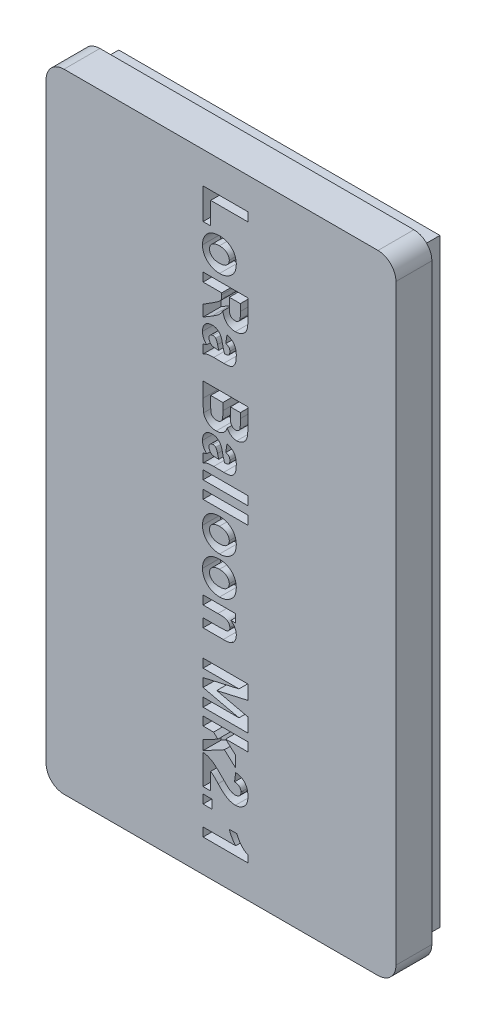
from build123d import *

# Parameters (mm, degrees)
SKETCH1_W           = 39
SKETCH1_H           = 70
BOSS_EXTRUDE1_DEPTH = 4
SKETCH2_W           = 35.8
SKETCH2_H           = 66.8
SKETCH2_W_2         = 32.2
SKETCH2_H_2         = 63.2
BOSS_EXTRUDE2_DEPTH = 2.5
SKETCH3_W           = 5
SKETCH3_H           = 0.974025974
SKETCH3_W_2         = 0.974025974
CUT_EXTRUDE1_DEPTH  = 2
FILLET1_R           = 2


with BuildPart() as part:
    # Sketch1 → Boss-Extrude1 (new body)
    with BuildSketch(Plane.XY):
        with Locations((19.5, 35)):
            Rectangle(SKETCH1_W, SKETCH1_H)
    extrude(amount=BOSS_EXTRUDE1_DEPTH)

    # Sketch2 → Boss-Extrude2 (add)
    with BuildSketch(Plane(origin=(0, 0, 0), x_dir=(-1, 0, 0), z_dir=(0, 0, -1))):
        with Locations((-19.5, 35)):
            Rectangle(SKETCH2_W, SKETCH2_H)
        with Locations((-19.5, 35)):
            Rectangle(SKETCH2_W_2, SKETCH2_H_2, mode=Mode.SUBTRACT)
    extrude(amount=BOSS_EXTRUDE2_DEPTH)

    # Sketch3 → Cut-Extrude1 (cut)
    # profile 1 of 16: a face of its own
    with BuildSketch(Plane.XY.offset(4)):
        Polygon((17.5, 66.480519481), (22.5, 66.480519481), (22.5, 65.506493506), (18.344155844, 65.506493506), (18.344155844, 63.038961039), (17.5, 63.038961039), align=None)
    # profile 2 of 16: a face of its own
    with BuildSketch(Plane.XY.offset(4)):
        with BuildLine():
            add(Edge.make_bspline(
                [(19.368912338, 62.584415584), (19.412557514, 62.583528419), (19.49897445, 62.581771843), (19.627236649, 62.5710115), (19.752443405, 62.550019945), (19.874785917, 62.522884131), (19.994516204, 62.488790148), (20.110184764, 62.444132033), (20.223974613, 62.394264811), (20.333175225, 62.334768256), (20.438197721, 62.270617637), (20.536987544, 62.200578377), (20.628149795, 62.124897448), (20.714126756, 62.046482053), (20.791131896, 61.96084051), (20.863823807, 61.87250186), (20.92718966, 61.777238739), (20.985571825, 61.679054138), (21.035971814, 61.57595743), (21.08098851, 61.470239525), (21.116953951, 61.36023349), (21.149170134, 61.248554471), (21.171961312, 61.132698684), (21.189429104, 61.014236637), (21.199791408, 60.892231578), (21.200792678, 60.809881336), (21.201298701, 60.768262987)],
                knots=[0, 0, 0, 0, 1.087797627, 2.153826546, 3.204146119, 4.249074796, 5.276002369, 6.302929943, 7.33671768, 8.369955531, 9.399197913, 10.402506754, 11.384561342, 12.350717656, 13.299250364, 14.252266119, 15.199037181, 16.147307724, 17.097187567, 18.056740571, 19.008264324, 19.97962709, 20.951574749, 21.948063114, 22.962987564, 24, 24, 24, 24], degree=3))
            add(Edge.make_bspline(
                [(21.201298701, 60.768262987), (21.199450512, 60.699196986), (21.195849872, 60.564642667), (21.170584758, 60.368376346), (21.126764803, 60.183837211), (21.066175813, 60.009883847), (20.986134267, 59.848038854), (20.89046985, 59.696280054), (20.776185609, 59.556703738), (20.645110832, 59.431081694), (20.503737769, 59.317759151), (20.354365117, 59.219397997), (20.199648716, 59.135604234), (20.038921137, 59.06728619), (19.872434276, 59.012800493), (19.69920372, 58.976348227), (19.520815843, 58.951385416), (19.399776993, 58.949172654), (19.338474026, 58.948051948)],
                knots=[0, 0, 0, 0, 1.136040707, 2.213233445, 3.248238065, 4.25119704, 5.236487175, 6.211911138, 7.196384178, 8.195725979, 9.1931767, 10.173001403, 11.133846892, 12.083513917, 13.042376269, 14.010298635, 14.992269034, 16, 16, 16, 16], degree=3))
            add(Edge.make_bspline(
                [(19.338474026, 58.948051948), (19.292785106, 58.948788827), (19.202258032, 58.950248863), (19.068171932, 58.963209219), (18.937242639, 58.981822592), (18.809553931, 59.009724143), (18.685290231, 59.044636463), (18.564480208, 59.089004836), (18.44727316, 59.140577304), (18.333494925, 59.199149596), (18.225970918, 59.265135773), (18.123494513, 59.334835969), (18.029544059, 59.411267865), (17.941646307, 59.491770536), (17.860288246, 59.576913906), (17.78604347, 59.667487133), (17.718822759, 59.763088903), (17.659365223, 59.863436801), (17.60640402, 59.967101274), (17.560648674, 60.073877485), (17.522295574, 60.183113435), (17.490858341, 60.294665106), (17.464721949, 60.408267799), (17.448553753, 60.525095631), (17.436196394, 60.643879325), (17.435443702, 60.723924483), (17.435064935, 60.764204545)],
                knots=[0, 0, 0, 0, 1.117558833, 2.214307803, 3.293244786, 4.351421184, 5.409597582, 6.448807362, 7.497331125, 8.540978692, 9.576922014, 10.582241184, 11.570837346, 12.537122916, 13.496974449, 14.449450387, 15.399839374, 16.353464778, 17.300823134, 18.246083241, 19.193441597, 20.131138339, 21.080698472, 22.042616426, 23.015011865, 24, 24, 24, 24], degree=3))
            add(Edge.make_bspline(
                [(17.435064935, 60.764204545), (17.436658538, 60.82819482), (17.439789185, 60.953904305), (17.463432675, 61.138408962), (17.502852243, 61.314388167), (17.558226745, 61.482119319), (17.627904833, 61.641994397), (17.714623801, 61.793107632), (17.81848662, 61.934619784), (17.935324792, 62.068380592), (18.067007303, 62.190741631), (18.213695075, 62.296408751), (18.373969277, 62.385342747), (18.547080851, 62.458460327), (18.733816486, 62.515186359), (18.933919374, 62.555416358), (19.147111308, 62.580032759), (19.2937634, 62.582930629), (19.368912338, 62.584415584)],
                knots=[0, 0, 0, 0, 1.024594995, 2.012826322, 2.973358778, 3.908543225, 4.837401023, 5.761810751, 6.69243552, 7.644223827, 8.602462928, 9.564551743, 10.532007457, 11.531954493, 12.568505162, 13.651979317, 14.796803673, 16, 16, 16, 16], degree=3))
        make_face()
        with BuildLine():
            add(Edge.make_bspline(
                [(19.318181818, 61.61038961), (19.274202345, 61.609514753), (19.188802006, 61.607815935), (19.06447938, 61.597454177), (18.948875339, 61.576133409), (18.840572969, 61.551320566), (18.74158396, 61.514609688), (18.649820783, 61.472887948), (18.56681123, 61.421567934), (18.493039432, 61.362821614), (18.42822013, 61.298508427), (18.370720871, 61.231285957), (18.322007126, 61.160767582), (18.282867351, 61.08637229), (18.252505923, 61.009070471), (18.22979593, 60.928280791), (18.216410588, 60.84413299), (18.214997021, 60.786910979), (18.214285714, 60.758116883)],
                knots=[0, 0, 0, 0, 1.347985487, 2.617548842, 3.817114289, 4.948286482, 6.017057593, 7.046407217, 8.032969353, 8.999289909, 9.930051738, 10.827140183, 11.706817169, 12.550594062, 13.397420762, 14.247349517, 15.118066881, 16, 16, 16, 16], degree=3))
            add(Edge.make_bspline(
                [(18.214285714, 60.758116883), (18.214996693, 60.729997883), (18.216409584, 60.674118493), (18.22979937, 60.591986829), (18.252500735, 60.513209195), (18.283226956, 60.437266744), (18.322589441, 60.364118347), (18.372121703, 60.295009085), (18.429215162, 60.228477216), (18.495143433, 60.165972865), (18.568962581, 60.10742814), (18.652801437, 60.057929707), (18.744850541, 60.016383128), (18.844755807, 59.9820163), (18.95291975, 59.954389132), (19.06972451, 59.935560347), (19.194861198, 59.924502338), (19.280956327, 59.922901926), (19.325284091, 59.922077922)],
                knots=[0, 0, 0, 0, 0.86498205, 1.718932724, 2.552529207, 3.383717481, 4.236080589, 5.102502034, 5.995588818, 6.930639414, 7.894730959, 8.889086482, 9.918564038, 10.998334367, 12.1369617, 13.350269694, 14.635734454, 16, 16, 16, 16], degree=3))
            add(Edge.make_bspline(
                [(19.325284091, 59.922077922), (19.368590511, 59.92294123), (19.452647024, 59.924616887), (19.574907493, 59.935124228), (19.689038528, 59.955995868), (19.795406311, 59.98277939), (19.894048552, 60.017465181), (19.984674312, 60.059961661), (20.067601966, 60.110789288), (20.141273702, 60.170017786), (20.207179656, 60.233571266), (20.264268467, 60.301112354), (20.313794055, 60.371246694), (20.353151989, 60.445402526), (20.383867427, 60.522357638), (20.406564098, 60.602146516), (20.419954045, 60.685284735), (20.421366945, 60.74183557), (20.422077922, 60.770292208)],
                knots=[0, 0, 0, 0, 1.337232047, 2.595528913, 3.783536199, 4.915617704, 5.97906533, 7.006690339, 8.000659516, 8.974235141, 9.919454987, 10.823278711, 11.700968276, 12.565199868, 13.408680491, 14.254935835, 15.121875735, 16, 16, 16, 16], degree=3))
            add(Edge.make_bspline(
                [(20.422077922, 60.770292208), (20.421415795, 60.798756777), (20.420115523, 60.854654965), (20.40626498, 60.937027866), (20.384085777, 61.015940839), (20.353098004, 61.092139731), (20.313828021, 61.165346709), (20.263910312, 61.234471195), (20.207514915, 61.301932386), (20.141196663, 61.364462993), (20.067164898, 61.422965991), (19.98383727, 61.473238788), (19.892800776, 61.516296387), (19.793326134, 61.550568631), (19.686106775, 61.57781848), (19.57038669, 61.59703671), (19.446909753, 61.607908449), (19.361831476, 61.609548287), (19.318181818, 61.61038961)],
                knots=[0, 0, 0, 0, 0.8777483, 1.723705717, 2.56959874, 3.403036217, 4.257705828, 5.126471818, 6.029908573, 6.967489424, 7.934189811, 8.936630112, 9.963815147, 11.036651848, 12.178360317, 13.374360467, 14.652907978, 16, 16, 16, 16], degree=3))
        make_face(mode=Mode.SUBTRACT)
    # profile 3 of 16: a face of its own
    with BuildSketch(Plane.XY.offset(4)):
        with BuildLine():
            Line((17.5, 58.168831169), (22.5, 58.168831169))
            Line((22.5, 58.168831169), (22.5, 56.110186688))
            add(Edge.make_bspline(
                [(22.5, 56.110186688), (22.49959964, 56.046602106), (22.498828535, 55.924136317), (22.493283254, 55.747468762), (22.481516393, 55.585151171), (22.468334076, 55.43675353), (22.44896646, 55.30271048), (22.42582199, 55.182450855), (22.399160183, 55.076128095), (22.35746947, 54.953987396), (22.289037207, 54.817258993), (22.182950283, 54.66927317), (22.052390783, 54.53611038), (21.925015541, 54.43986879), (21.812438114, 54.37314975), (21.723389173, 54.327896019), (21.629222447, 54.291835754), (21.531340355, 54.261110267), (21.429311402, 54.236872009), (21.322862278, 54.219582969), (21.212666288, 54.209296583), (21.137738396, 54.208297549), (21.099837662, 54.207792208)],
                knots=[0, 0, 0, 0, 1.403336213, 2.702867097, 3.89994726, 4.994709233, 5.990128961, 6.887471613, 7.696701944, 8.407207329, 9.732421867, 11.053910544, 12.410433107, 13.833109191, 14.562763883, 15.297137368, 16.03453921, 16.78526912, 17.560138056, 18.346710252, 19.163717375, 20, 20, 20, 20], degree=3))
            add(Edge.make_bspline(
                [(21.099837662, 54.207792208), (21.05209605, 54.208614176), (20.95868939, 54.21022236), (20.822344048, 54.22725247), (20.692703782, 54.252832759), (20.570856368, 54.291197991), (20.454791296, 54.337103071), (20.347190843, 54.396787046), (20.24618256, 54.465982623), (20.152440065, 54.5452996), (20.067090469, 54.635039834), (19.990096905, 54.733862805), (19.920315295, 54.840706945), (19.860965804, 54.957551266), (19.807585822, 55.082277929), (19.764568325, 55.216986165), (19.728740241, 55.360000336), (19.712183605, 55.459007884), (19.703733766, 55.509537338)],
                knots=[0, 0, 0, 0, 1.084141299, 2.12112686, 3.117250271, 4.082180618, 5.019674211, 5.948149429, 6.871043381, 7.797863675, 8.732676681, 9.679570512, 10.640822351, 11.627176691, 12.653315453, 13.72007994, 14.836420889, 16, 16, 16, 16], degree=3))
            add(Edge.make_bspline(
                [(19.703733766, 55.509537338), (19.672285899, 55.457018332), (19.611037345, 55.354731166), (19.509893003, 55.212066964), (19.404961729, 55.083111517), (19.310752977, 54.984867186), (19.227578847, 54.909973227), (19.154264031, 54.850296479), (19.069920557, 54.786454973), (18.973984887, 54.718383278), (18.866785434, 54.645602751), (18.747978614, 54.56859415), (18.617651859, 54.487241259), (18.526522549, 54.432236426), (18.479099026, 54.403612013)],
                knots=[0, 0, 0, 0, 1.316447784, 2.563942512, 3.758196669, 4.89017242, 5.487731481, 6.164970468, 6.923081098, 7.76291089, 8.695186333, 9.710230341, 10.808408125, 12, 12, 12, 12], degree=3))
            Line((18.479099026, 54.403612013), (17.5, 53.818181818))
            Line((17.5, 53.818181818), (17.5, 55.052962662))
            Line((17.5, 55.052962662), (18.576501623, 55.745941558))
            add(Edge.make_bspline(
                [(18.576501623, 55.745941558), (18.622838875, 55.776035915), (18.711185346, 55.833413728), (18.836924232, 55.915199926), (18.948969559, 55.989958436), (19.048256469, 56.055680165), (19.132514105, 56.116606493), (19.204439987, 56.16757582), (19.262804516, 56.211341042), (19.321633384, 56.258982938), (19.380679389, 56.315703915), (19.440089246, 56.3840759), (19.486730917, 56.455464852), (19.523082043, 56.531650484), (19.549023303, 56.620907303), (19.56623292, 56.72849369), (19.575452702, 56.858133753), (19.577057051, 56.951622344), (19.577922078, 57.002029221)],
                knots=[0, 0, 0, 0, 1.540630534, 2.937361724, 4.182336204, 5.296545873, 6.256860607, 7.081241145, 7.754565199, 8.290682583, 9.191113071, 10.033949391, 10.810788607, 11.561665679, 12.379113064, 13.39303176, 14.594383257, 16, 16, 16, 16], degree=3))
            Line((19.577922078, 57.002029221), (19.577922078, 57.194805195))
            Line((19.577922078, 57.194805195), (17.5, 57.194805195))
            Line((17.5, 57.194805195), (17.5, 58.168831169))
        make_face()
        with BuildLine():
            Line((20.422077922, 57.194805195), (20.422077922, 56.480519481))
            add(Edge.make_bspline(
                [(20.422077922, 56.480519481), (20.422360992, 56.428436187), (20.422899583, 56.329338772), (20.424522386, 56.187944599), (20.428762736, 56.061455316), (20.433738572, 55.949833792), (20.439463925, 55.853034526), (20.447175783, 55.771067013), (20.45718866, 55.704030712), (20.471404412, 55.635039214), (20.497429019, 55.56218402), (20.541179974, 55.485039129), (20.595020472, 55.414693496), (20.662845147, 55.354665816), (20.74267145, 55.305026133), (20.835511744, 55.270942117), (20.939989681, 55.25048374), (21.013494264, 55.248038972), (21.052150974, 55.246753247)],
                knots=[0, 0, 0, 0, 1.560937284, 2.96995135, 4.237567709, 5.353650601, 6.318464703, 7.143454388, 7.820048429, 8.348858403, 9.25293029, 10.124191563, 10.998043079, 11.895328271, 12.823620657, 13.798761283, 14.842349086, 16, 16, 16, 16], degree=3))
            add(Edge.make_bspline(
                [(21.052150974, 55.246753247), (21.089110033, 55.248089887), (21.159913547, 55.250650527), (21.260502807, 55.270707591), (21.349801982, 55.30534349), (21.426865286, 55.354919176), (21.492474654, 55.4165156), (21.546236077, 55.488760187), (21.591503058, 55.569477796), (21.609903288, 55.629161273), (21.619318182, 55.659699675)],
                knots=[0, 0, 0, 0, 1.164311867, 2.230505154, 3.21629184, 4.165493112, 5.100643873, 6.036584124, 6.995373831, 8, 8, 8, 8], degree=3))
            add(Edge.make_bspline(
                [(21.619318182, 55.659699675), (21.622152214, 55.673542437), (21.628891215, 55.706458933), (21.636815241, 55.764342618), (21.642174412, 55.838215662), (21.647313084, 55.927849931), (21.651101857, 56.033393596), (21.654449891, 56.155147368), (21.654715225, 56.292818734), (21.655454959, 56.389881783), (21.655844156, 56.440949675)],
                knots=[0, 0, 0, 0, 0.432971861, 1.029557334, 1.788740938, 2.702316591, 3.781055348, 5.025222918, 6.434877167, 8, 8, 8, 8], degree=3))
            Line((21.655844156, 56.440949675), (21.655844156, 57.194805195))
            Line((21.655844156, 57.194805195), (20.422077922, 57.194805195))
        make_face(mode=Mode.SUBTRACT)
    # profile 4 of 16: a face of its own
    with BuildSketch(Plane.XY.offset(4)):
        with BuildLine():
            Line((20.032467532, 52.519480519), (20.162337662, 53.428571429))
            add(Edge.make_bspline(
                [(20.162337662, 53.428571429), (20.20719306, 53.415691623), (20.294450645, 53.390636429), (20.418210578, 53.34335307), (20.533095669, 53.292058446), (20.637670757, 53.2327813), (20.733439233, 53.168522975), (20.818332941, 53.09658976), (20.893880795, 53.019221267), (20.960550687, 52.935474488), (21.018112561, 52.843478314), (21.067731107, 52.742880485), (21.109302392, 52.632741745), (21.142396799, 52.513422221), (21.168715692, 52.384935912), (21.187893956, 52.247034659), (21.198845125, 52.099609618), (21.20046527, 51.998327146), (21.201298701, 51.946225649)],
                knots=[0, 0, 0, 0, 1.125515524, 2.189474865, 3.193709533, 4.158305409, 5.086274303, 5.972285183, 6.837881566, 7.691743787, 8.549806887, 9.451203831, 10.393874208, 11.385866739, 12.435713252, 13.556277782, 14.742906037, 16, 16, 16, 16], degree=3))
            add(Edge.make_bspline(
                [(21.201298701, 51.946225649), (21.201065942, 51.899877691), (21.200613715, 51.809828678), (21.192639745, 51.678941652), (21.183453447, 51.556293549), (21.168254125, 51.442124789), (21.147871153, 51.336527011), (21.123918854, 51.239177262), (21.095484812, 51.150333568), (21.053298642, 51.045537469), (20.990036334, 50.930029242), (20.901736264, 50.808898551), (20.798905797, 50.710331005), (20.701948242, 50.644080397), (20.613079567, 50.60315076), (20.533918189, 50.577669987), (20.442731226, 50.555247458), (20.339287857, 50.537500848), (20.223475224, 50.523487201), (20.095514823, 50.513621989), (19.955416661, 50.507532466), (19.857961248, 50.506849219), (19.807224026, 50.506493506)],
                knots=[0, 0, 0, 0, 1.172645795, 2.278322549, 3.317437237, 4.284552983, 5.190951134, 6.037858116, 6.820064311, 7.549551753, 8.893788561, 10.141635195, 11.328036199, 12.481663495, 13.094362176, 13.79803918, 14.582676335, 15.469136844, 16.45214095, 17.533908717, 18.716103928, 20, 20, 20, 20], degree=3))
            Line((19.807224026, 50.506493506), (18.689123377, 50.51461039))
            add(Edge.make_bspline(
                [(18.689123377, 50.51461039), (18.651245726, 50.514294596), (18.577852753, 50.513682703), (18.471594239, 50.512431592), (18.372858153, 50.506800527), (18.281554432, 50.500655264), (18.197471505, 50.494505328), (18.121165633, 50.483591402), (18.052284959, 50.473158955), (17.969560894, 50.455108068), (17.869356028, 50.42503735), (17.74867523, 50.378093511), (17.624021205, 50.319072636), (17.542270007, 50.271401782), (17.5, 50.246753247)],
                knots=[0, 0, 0, 0, 1.100960395, 2.13325684, 3.08799504, 3.974623839, 4.793377983, 5.537123068, 6.214225653, 6.817686965, 7.996461938, 9.250537039, 10.578371695, 12, 12, 12, 12], degree=3))
            Line((17.5, 50.246753247), (17.5, 51.220779221))
            Line((17.5, 51.220779221), (17.897727273, 51.339488636))
            add(Edge.make_bspline(
                [(17.897727273, 51.339488636), (17.859360735, 51.378659846), (17.784707234, 51.454879074), (17.688641004, 51.579374361), (17.607826166, 51.707185677), (17.543543882, 51.840060964), (17.494429822, 51.977200236), (17.460175543, 52.118356728), (17.439245859, 52.263849149), (17.436470563, 52.362146366), (17.435064935, 52.411931818)],
                knots=[0, 0, 0, 0, 1.094238684, 2.129166538, 3.133671034, 4.10942336, 5.070833053, 6.037377746, 7.005973528, 8, 8, 8, 8], degree=3))
            add(Edge.make_bspline(
                [(17.435064935, 52.411931818), (17.436196198, 52.452883747), (17.438417837, 52.533307461), (17.451225957, 52.651233519), (17.474624664, 52.763299387), (17.5076296, 52.869303813), (17.547536028, 52.970535302), (17.599137275, 53.065280202), (17.658950235, 53.154839855), (17.72770078, 53.238115806), (17.804914915, 53.312403446), (17.886913645, 53.37988358), (17.977266308, 53.433812533), (18.071973861, 53.480965293), (18.174096818, 53.514377114), (18.281528935, 53.540376537), (18.395128698, 53.555597497), (18.472967275, 53.557482325), (18.512581169, 53.558441558)],
                knots=[0, 0, 0, 0, 1.111028414, 2.181900458, 3.212888925, 4.21115239, 5.190734394, 6.159429897, 7.131421471, 8.108723925, 9.081883785, 10.034678926, 10.981892532, 11.929727932, 12.898727489, 13.888948844, 14.925636122, 16, 16, 16, 16], degree=3))
            add(Edge.make_bspline(
                [(18.512581169, 53.558441558), (18.562728581, 53.556889309), (18.660210948, 53.553871867), (18.801417536, 53.530305427), (18.932652513, 53.49093437), (19.053137607, 53.434421777), (19.162868726, 53.36437675), (19.262007438, 53.281256988), (19.348206816, 53.183941956), (19.411268145, 53.092633998), (19.457348311, 53.010976391), (19.488801873, 52.939353837), (19.521903707, 52.860662202), (19.551693844, 52.772493261), (19.582392237, 52.676262773), (19.611730086, 52.571066917), (19.638745813, 52.456793731), (19.656154942, 52.377796886), (19.665178571, 52.336850649)],
                knots=[0, 0, 0, 0, 1.294162278, 2.515743014, 3.684113667, 4.820865117, 5.939906549, 7.036651616, 8.149715676, 9.285662014, 9.895437351, 10.567486448, 11.303637924, 12.098932185, 12.968810962, 13.91153998, 14.917493754, 16, 16, 16, 16], degree=3))
            add(Edge.make_bspline(
                [(19.665178571, 52.336850649), (19.675447193, 52.287425487), (19.695178402, 52.192454782), (19.727063699, 52.056316793), (19.757224442, 51.931779605), (19.786558499, 51.818685487), (19.815533819, 51.717366448), (19.845353454, 51.627940328), (19.873024169, 51.549807839), (19.893250832, 51.502417949), (19.902597403, 51.480519481)],
                knots=[0, 0, 0, 0, 1.361164628, 2.615484881, 3.770095419, 4.816364149, 5.765912261, 6.610903979, 7.358110453, 8, 8, 8, 8], degree=3))
            add(Edge.make_bspline(
                [(19.902597403, 51.480519481), (19.946562127, 51.481232522), (20.026443529, 51.482528078), (20.134084546, 51.488297217), (20.217051281, 51.500778797), (20.279754281, 51.51823568), (20.326272153, 51.546991338), (20.366333468, 51.581441425), (20.40050469, 51.626229317), (20.431853941, 51.678910853), (20.457013728, 51.742456573), (20.475081855, 51.817171002), (20.484463112, 51.903377417), (20.486127741, 51.964468224), (20.487012987, 51.996956169)],
                knots=[0, 0, 0, 0, 1.704637254, 3.09722893, 4.172654963, 4.956246112, 5.596985007, 6.275246559, 6.99385986, 7.769515704, 8.645866914, 9.631493719, 10.740434052, 12, 12, 12, 12], degree=3))
            add(Edge.make_bspline(
                [(20.487012987, 51.996956169), (20.486048403, 52.030216444), (20.484220622, 52.093241041), (20.46511142, 52.182020678), (20.436865352, 52.260706291), (20.392081016, 52.328409486), (20.331148168, 52.387726745), (20.250139095, 52.438941536), (20.148822864, 52.484227608), (20.07303212, 52.50719041), (20.032467532, 52.519480519)],
                knots=[0, 0, 0, 0, 1.045871977, 1.981813381, 2.848317391, 3.663751395, 4.514929533, 5.507645304, 6.666046366, 8, 8, 8, 8], degree=3))
        make_face()
        with BuildLine():
            add(Edge.make_bspline(
                [(19.253246753, 51.480519481), (19.242902471, 51.510215942), (19.219887127, 51.576288602), (19.186657715, 51.687280513), (19.151554448, 51.820434594), (19.127949707, 51.916761496), (19.11525974, 51.968547078)],
                knots=[0, 0, 0, 0, 0.743632693, 1.654533494, 2.73907137, 4, 4, 4, 4], degree=3))
            add(Edge.make_bspline(
                [(19.11525974, 51.968547078), (19.107773576, 51.999066387), (19.09347914, 52.057341404), (19.068312447, 52.139900909), (19.045017306, 52.214838789), (19.018856579, 52.281109366), (18.994468642, 52.339977222), (18.967850056, 52.390138496), (18.940858395, 52.432128311), (18.920695301, 52.455743787), (18.911323052, 52.466720779)],
                knots=[0, 0, 0, 0, 1.388607462, 2.65147299, 3.814389992, 4.855436495, 5.799565367, 6.62877246, 7.362623276, 8, 8, 8, 8], degree=3))
            add(Edge.make_bspline(
                [(18.911323052, 52.466720779), (18.8921243, 52.48498234), (18.854201425, 52.521054002), (18.783420009, 52.55770184), (18.705480812, 52.580926081), (18.650404864, 52.583232655), (18.622159091, 52.584415584)],
                knots=[0, 0, 0, 0, 0.985740837, 1.947112291, 2.947173789, 4, 4, 4, 4], degree=3))
            add(Edge.make_bspline(
                [(18.622159091, 52.584415584), (18.589843357, 52.583021662), (18.527262696, 52.580322278), (18.437477164, 52.554408327), (18.355250624, 52.514023038), (18.283687216, 52.456492464), (18.22311162, 52.388656918), (18.18117901, 52.308680508), (18.153141138, 52.221698667), (18.150630123, 52.160194587), (18.149350649, 52.128855519)],
                knots=[0, 0, 0, 0, 1.056198986, 2.045369905, 3.036276429, 4.038084886, 5.035473036, 5.992159802, 6.976916006, 8, 8, 8, 8], degree=3))
            add(Edge.make_bspline(
                [(18.149350649, 52.128855519), (18.150811117, 52.099659231), (18.153749602, 52.040915817), (18.175060673, 51.953250177), (18.210348574, 51.866593217), (18.257143782, 51.781964229), (18.313408733, 51.704238415), (18.377238864, 51.638276618), (18.445522965, 51.584698065), (18.508215375, 51.550164762), (18.564336552, 51.52974552), (18.614132649, 51.517350335), (18.671106722, 51.504488836), (18.73599926, 51.496175812), (18.8083937, 51.488942309), (18.888609575, 51.484087177), (18.976572048, 51.481042641), (19.037808259, 51.480698276), (19.069602273, 51.480519481)],
                knots=[0, 0, 0, 0, 1.093500888, 2.200141778, 3.360346716, 4.591280596, 5.815607582, 6.94487563, 8.019710678, 9.057444999, 9.610729159, 10.253199895, 10.979011171, 11.798077413, 12.702238226, 13.705425431, 14.808650418, 16, 16, 16, 16], degree=3))
            Line((19.069602273, 51.480519481), (19.253246753, 51.480519481))
        make_face(mode=Mode.SUBTRACT)
    # profile 5 of 16: a face of its own
    with BuildSketch(Plane.XY.offset(4)):
        with BuildLine():
            Line((22.5, 47.649350649), (22.5, 45.67288961))
            add(Edge.make_bspline(
                [(22.5, 45.67288961), (22.499510508, 45.607953461), (22.498569611, 45.483133666), (22.49422381, 45.303102482), (22.483811423, 45.138364666), (22.470564301, 44.988512548), (22.455512523, 44.853521205), (22.43354904, 44.733531783), (22.410454756, 44.628078623), (22.372346197, 44.508564591), (22.311256991, 44.374074499), (22.214593191, 44.227673845), (22.095034223, 44.094011681), (21.97810006, 43.996078395), (21.8757626, 43.925997023), (21.795897158, 43.878833509), (21.712358841, 43.840481963), (21.626704996, 43.8092457), (21.539220203, 43.78290298), (21.448294252, 43.766638427), (21.355175757, 43.754383036), (21.291979777, 43.753627393), (21.260146104, 43.753246753)],
                knots=[0, 0, 0, 0, 1.498327689, 2.88007457, 4.154414764, 5.305986542, 6.351317343, 7.286582663, 8.11946184, 8.840080679, 10.177555878, 11.512935148, 12.872513647, 14.301275782, 15.019863751, 15.733221227, 16.438466007, 17.137161526, 17.836031326, 18.543086972, 19.26611006, 20, 20, 20, 20], degree=3))
            add(Edge.make_bspline(
                [(21.260146104, 43.753246753), (21.202105001, 43.755485812), (21.087543876, 43.759905252), (20.920765624, 43.79810736), (20.761932145, 43.858055109), (20.615000736, 43.943704109), (20.481401724, 44.047765172), (20.364799949, 44.167606909), (20.265191479, 44.301102254), (20.216326185, 44.400377793), (20.191761364, 44.450284091)],
                knots=[0, 0, 0, 0, 1.031817477, 2.036594177, 3.029254201, 4.043130586, 5.050931669, 6.034203586, 7.01178454, 8, 8, 8, 8], degree=3))
            add(Edge.make_bspline(
                [(20.191761364, 44.450284091), (20.180408131, 44.416287018), (20.157967235, 44.349088119), (20.116343614, 44.252659833), (20.06809293, 44.162227014), (20.015869675, 44.076187911), (19.955607962, 43.997337562), (19.890207728, 43.92405518), (19.820283436, 43.855071709), (19.742926309, 43.794197199), (19.662096521, 43.737461267), (19.575284811, 43.69015268), (19.484730675, 43.649429465), (19.389910421, 43.615433398), (19.290221661, 43.590554622), (19.186475614, 43.572312866), (19.078647266, 43.560901805), (19.005371576, 43.559270435), (18.968141234, 43.558441558)],
                knots=[0, 0, 0, 0, 1.053917501, 2.08318216, 3.084375989, 4.067115349, 5.039987852, 5.998256831, 6.954975631, 7.924383767, 8.890110205, 9.856297623, 10.826929889, 11.808561028, 12.814635272, 13.844956918, 14.905053061, 16, 16, 16, 16], degree=3))
            add(Edge.make_bspline(
                [(18.968141234, 43.558441558), (18.9227856, 43.559463749), (18.833877117, 43.5614675), (18.70319974, 43.575812502), (18.577900082, 43.600017259), (18.458161501, 43.634652918), (18.343560388, 43.678337479), (18.234505267, 43.732361982), (18.130887303, 43.796661174), (18.032915411, 43.869422249), (17.942563815, 43.948763771), (17.860795079, 44.032806893), (17.787141142, 44.119564208), (17.724510591, 44.211716821), (17.669294272, 44.306011839), (17.623026085, 44.403869017), (17.587612024, 44.505811991), (17.570479131, 44.575607427), (17.561891234, 44.610592532)],
                knots=[0, 0, 0, 0, 1.145607172, 2.24567906, 3.316329682, 4.365460088, 5.390414304, 6.410550385, 7.434792233, 8.46684308, 9.489944109, 10.468671886, 11.426900475, 12.36059261, 13.279351643, 14.185149476, 15.09030244, 16, 16, 16, 16], degree=3))
            add(Edge.make_bspline(
                [(17.561891234, 44.610592532), (17.556921702, 44.639303553), (17.545619634, 44.704600237), (17.532705073, 44.815630372), (17.523758584, 44.951103494), (17.513827495, 45.111024653), (17.50891179, 45.29544384), (17.503367379, 45.504435965), (17.500552852, 45.737817581), (17.500190272, 45.90151478), (17.5, 45.987418831)],
                knots=[0, 0, 0, 0, 0.506837559, 1.152686718, 1.943271314, 2.868501158, 3.939884368, 5.152247396, 6.505573166, 8, 8, 8, 8], degree=3))
            Line((17.5, 45.987418831), (17.5, 47.649350649))
            Line((17.5, 47.649350649), (22.5, 47.649350649))
        make_face()
        with BuildLine():
            Line((21.655844156, 46.675324675), (20.551948052, 46.675324675))
            Line((20.551948052, 46.675324675), (20.551948052, 46.011769481))
            add(Edge.make_bspline(
                [(20.551948052, 46.011769481), (20.551832573, 45.964420376), (20.551613161, 45.874455737), (20.553078644, 45.746619834), (20.553523744, 45.632968979), (20.556054718, 45.53355312), (20.557413467, 45.448626051), (20.561000441, 45.377977453), (20.563239725, 45.321405165), (20.566697363, 45.28834243), (20.568181818, 45.274147727)],
                knots=[0, 0, 0, 0, 1.539755574, 2.925579234, 4.157432792, 5.235486124, 6.159601295, 6.919197766, 7.535983151, 8, 8, 8, 8], degree=3))
            add(Edge.make_bspline(
                [(20.568181818, 45.274147727), (20.574850885, 45.233318916), (20.587561075, 45.155505632), (20.623558152, 45.046431326), (20.673053822, 44.95161873), (20.735797333, 44.87023717), (20.812202827, 44.80538307), (20.902673883, 44.759958125), (21.004824377, 44.731851843), (21.077324625, 44.728840143), (21.115056818, 44.727272727)],
                knots=[0, 0, 0, 0, 1.156043088, 2.203236031, 3.197816213, 4.134692963, 5.061434266, 5.975433912, 6.946330216, 8, 8, 8, 8], degree=3))
            add(Edge.make_bspline(
                [(21.115056818, 44.727272727), (21.149032561, 44.728367007), (21.214080817, 44.730462061), (21.306372262, 44.753914247), (21.389289762, 44.790138513), (21.46058487, 44.842794), (21.519444964, 44.905725062), (21.568910588, 44.974318265), (21.603119906, 45.050430891), (21.622591975, 45.120766342), (21.633137435, 45.189338769), (21.637857773, 45.260943637), (21.644929767, 45.352168788), (21.647622572, 45.462874611), (21.652717015, 45.593373033), (21.653579458, 45.743241676), (21.656517581, 45.91266634), (21.656076539, 46.032059799), (21.655844156, 46.094967532)],
                knots=[0, 0, 0, 0, 0.973031789, 1.862917975, 2.714444411, 3.555113712, 4.385861934, 5.180259999, 5.970734499, 6.766732084, 7.267820327, 7.959442945, 8.825288207, 9.893716152, 11.136763095, 12.573466007, 14.194578749, 16, 16, 16, 16], degree=3))
            Line((21.655844156, 46.094967532), (21.655844156, 46.675324675))
        make_face(mode=Mode.SUBTRACT)
        with BuildLine():
            Line((19.707792208, 46.675324675), (18.344155844, 46.675324675))
            Line((18.344155844, 46.675324675), (18.344155844, 45.766233766))
            add(Edge.make_bspline(
                [(18.344155844, 45.766233766), (18.344435303, 45.718547013), (18.344968481, 45.627565962), (18.346641239, 45.498007918), (18.350663013, 45.381978963), (18.356469428, 45.279101151), (18.364765581, 45.189499659), (18.373086671, 45.113174385), (18.384557964, 45.05062612), (18.39957062, 44.98492682), (18.429541772, 44.914725809), (18.476477375, 44.839130124), (18.536381147, 44.769891211), (18.609251223, 44.709452134), (18.694258039, 44.659140716), (18.790519448, 44.622489145), (18.897872497, 44.601068618), (18.972775625, 44.598657699), (19.011769481, 44.597402597)],
                knots=[0, 0, 0, 0, 1.468823539, 2.802352852, 3.990613231, 5.044577628, 5.97542194, 6.762296442, 7.407977832, 7.933490854, 8.834961323, 9.742609811, 10.665728169, 11.642033707, 12.646065455, 13.694610711, 14.799836276, 16, 16, 16, 16], degree=3))
            add(Edge.make_bspline(
                [(19.011769481, 44.597402597), (19.051778275, 44.599020552), (19.128740306, 44.602132894), (19.239002361, 44.624211472), (19.337981776, 44.66306157), (19.42512846, 44.717703956), (19.500471478, 44.784762229), (19.562788623, 44.863068947), (19.613692581, 44.950567204), (19.644200012, 45.033261763), (19.662826125, 45.109634469), (19.674179052, 45.180962413), (19.685933, 45.265086938), (19.69291111, 45.363053142), (19.700780449, 45.473920979), (19.703815078, 45.598478993), (19.70740735, 45.736113144), (19.707660088, 45.832518088), (19.707792208, 45.882913961)],
                knots=[0, 0, 0, 0, 1.143215143, 2.19912046, 3.197116365, 4.165365694, 5.123819291, 6.065802965, 7.014162653, 8.005206416, 8.5725482, 9.259043701, 10.068343003, 10.999502645, 12.064921609, 13.244816419, 14.559722402, 16, 16, 16, 16], degree=3))
            Line((19.707792208, 45.882913961), (19.707792208, 46.675324675))
        make_face(mode=Mode.SUBTRACT)
    # profile 6 of 16: a face of its own
    with BuildSketch(Plane.XY.offset(4)):
        with BuildLine():
            Line((20.032467532, 42), (20.162337662, 42.909090909))
            add(Edge.make_bspline(
                [(20.162337662, 42.909090909), (20.20719306, 42.896211104), (20.294450645, 42.87115591), (20.418210578, 42.823872551), (20.533095669, 42.772577927), (20.637670757, 42.71330078), (20.733439233, 42.649042456), (20.818332941, 42.577109241), (20.893880795, 42.499740748), (20.960550687, 42.415993968), (21.018112561, 42.323997794), (21.067731107, 42.223399966), (21.109302392, 42.113261226), (21.142396799, 41.993941702), (21.168715692, 41.865455392), (21.187893956, 41.72755414), (21.198845125, 41.580129098), (21.20046527, 41.478846626), (21.201298701, 41.42674513)],
                knots=[0, 0, 0, 0, 1.125515524, 2.189474865, 3.193709533, 4.158305409, 5.086274303, 5.972285183, 6.837881566, 7.691743787, 8.549806887, 9.451203831, 10.393874208, 11.385866739, 12.435713252, 13.556277782, 14.742906037, 16, 16, 16, 16], degree=3))
            add(Edge.make_bspline(
                [(21.201298701, 41.42674513), (21.201065942, 41.380397172), (21.200613715, 41.290348158), (21.192639745, 41.159461132), (21.183453447, 41.03681303), (21.168254125, 40.922644269), (21.147871153, 40.817046491), (21.123918854, 40.719696742), (21.095484812, 40.630853049), (21.053298642, 40.52605695), (20.990036334, 40.410548722), (20.901736264, 40.289418032), (20.798905797, 40.190850485), (20.701948242, 40.124599878), (20.613079567, 40.08367024), (20.533918189, 40.058189468), (20.442731226, 40.035766939), (20.339287857, 40.018020328), (20.223475224, 40.004006681), (20.095514823, 39.994141469), (19.955416661, 39.988051947), (19.857961248, 39.987368699), (19.807224026, 39.987012987)],
                knots=[0, 0, 0, 0, 1.172645795, 2.278322549, 3.317437237, 4.284552983, 5.190951134, 6.037858116, 6.820064311, 7.549551753, 8.893788561, 10.141635195, 11.328036199, 12.481663495, 13.094362176, 13.79803918, 14.582676335, 15.469136844, 16.45214095, 17.533908717, 18.716103928, 20, 20, 20, 20], degree=3))
            Line((19.807224026, 39.987012987), (18.689123377, 39.99512987))
            add(Edge.make_bspline(
                [(18.689123377, 39.99512987), (18.651245726, 39.994814076), (18.577852753, 39.994202183), (18.471594239, 39.992951072), (18.372858153, 39.987320007), (18.281554432, 39.981174744), (18.197471505, 39.975024809), (18.121165633, 39.964110883), (18.052284959, 39.953678435), (17.969560894, 39.935627548), (17.869356028, 39.90555683), (17.74867523, 39.858612991), (17.624021205, 39.799592116), (17.542270007, 39.751921263), (17.5, 39.727272727)],
                knots=[0, 0, 0, 0, 1.100960395, 2.13325684, 3.08799504, 3.974623839, 4.793377983, 5.537123068, 6.214225653, 6.817686965, 7.996461938, 9.250537039, 10.578371695, 12, 12, 12, 12], degree=3))
            Line((17.5, 39.727272727), (17.5, 40.701298701))
            Line((17.5, 40.701298701), (17.897727273, 40.820008117))
            add(Edge.make_bspline(
                [(17.897727273, 40.820008117), (17.859360735, 40.859179326), (17.784707234, 40.935398555), (17.688641004, 41.059893842), (17.607826166, 41.187705157), (17.543543882, 41.320580444), (17.494429822, 41.457719716), (17.460175543, 41.598876208), (17.439245859, 41.74436863), (17.436470563, 41.842665847), (17.435064935, 41.892451299)],
                knots=[0, 0, 0, 0, 1.094238684, 2.129166538, 3.133671034, 4.10942336, 5.070833053, 6.037377746, 7.005973528, 8, 8, 8, 8], degree=3))
            add(Edge.make_bspline(
                [(17.435064935, 41.892451299), (17.436196198, 41.933403227), (17.438417837, 42.013826941), (17.451225957, 42.131752999), (17.474624664, 42.243818867), (17.5076296, 42.349823293), (17.547536028, 42.451054783), (17.599137275, 42.545799682), (17.658950235, 42.635359335), (17.72770078, 42.718635287), (17.804914915, 42.792922926), (17.886913645, 42.86040306), (17.977266308, 42.914332014), (18.071973861, 42.961484773), (18.174096818, 42.994896594), (18.281528935, 43.020896018), (18.395128698, 43.036116978), (18.472967275, 43.038001805), (18.512581169, 43.038961039)],
                knots=[0, 0, 0, 0, 1.111028414, 2.181900458, 3.212888925, 4.21115239, 5.190734394, 6.159429897, 7.131421471, 8.108723925, 9.081883785, 10.034678926, 10.981892532, 11.929727932, 12.898727489, 13.888948844, 14.925636122, 16, 16, 16, 16], degree=3))
            add(Edge.make_bspline(
                [(18.512581169, 43.038961039), (18.562728581, 43.03740879), (18.660210948, 43.034391347), (18.801417536, 43.010824907), (18.932652513, 42.971453851), (19.053137607, 42.914941257), (19.162868726, 42.844896231), (19.262007438, 42.761776468), (19.348206816, 42.664461437), (19.411268145, 42.573153479), (19.457348311, 42.491495871), (19.488801873, 42.419873318), (19.521903707, 42.341181682), (19.551693844, 42.253012742), (19.582392237, 42.156782254), (19.611730086, 42.051586397), (19.638745813, 41.937313211), (19.656154942, 41.858316366), (19.665178571, 41.81737013)],
                knots=[0, 0, 0, 0, 1.294162278, 2.515743014, 3.684113667, 4.820865117, 5.939906549, 7.036651616, 8.149715676, 9.285662014, 9.895437351, 10.567486448, 11.303637924, 12.098932185, 12.968810962, 13.91153998, 14.917493754, 16, 16, 16, 16], degree=3))
            add(Edge.make_bspline(
                [(19.665178571, 41.81737013), (19.675447193, 41.767944968), (19.695178402, 41.672974263), (19.727063699, 41.536836273), (19.757224442, 41.412299085), (19.786558499, 41.299204968), (19.815533819, 41.197885928), (19.845353454, 41.108459808), (19.873024169, 41.03032732), (19.893250832, 40.982937429), (19.902597403, 40.961038961)],
                knots=[0, 0, 0, 0, 1.361164628, 2.615484881, 3.770095419, 4.816364149, 5.765912261, 6.610903979, 7.358110453, 8, 8, 8, 8], degree=3))
            add(Edge.make_bspline(
                [(19.902597403, 40.961038961), (19.946562127, 40.961752003), (20.026443529, 40.963047558), (20.134084546, 40.968816697), (20.217051281, 40.981298278), (20.279754281, 40.99875516), (20.326272153, 41.027510819), (20.366333468, 41.061960905), (20.40050469, 41.106748797), (20.431853941, 41.159430334), (20.457013728, 41.222976054), (20.475081855, 41.297690482), (20.484463112, 41.383896898), (20.486127741, 41.444987705), (20.487012987, 41.477475649)],
                knots=[0, 0, 0, 0, 1.704637254, 3.09722893, 4.172654963, 4.956246112, 5.596985007, 6.275246559, 6.99385986, 7.769515704, 8.645866914, 9.631493719, 10.740434052, 12, 12, 12, 12], degree=3))
            add(Edge.make_bspline(
                [(20.487012987, 41.477475649), (20.486048403, 41.510735925), (20.484220622, 41.573760521), (20.46511142, 41.662540159), (20.436865352, 41.741225771), (20.392081016, 41.808928966), (20.331148168, 41.868246226), (20.250139095, 41.919461016), (20.148822864, 41.964747089), (20.07303212, 41.98770989), (20.032467532, 42)],
                knots=[0, 0, 0, 0, 1.045871977, 1.981813381, 2.848317391, 3.663751395, 4.514929533, 5.507645304, 6.666046366, 8, 8, 8, 8], degree=3))
        make_face()
        with BuildLine():
            add(Edge.make_bspline(
                [(19.253246753, 40.961038961), (19.242902471, 40.990735422), (19.219887127, 41.056808082), (19.186657715, 41.167799993), (19.151554448, 41.300954074), (19.127949707, 41.397280976), (19.11525974, 41.449066558)],
                knots=[0, 0, 0, 0, 0.743632693, 1.654533494, 2.73907137, 4, 4, 4, 4], degree=3))
            add(Edge.make_bspline(
                [(19.11525974, 41.449066558), (19.107773576, 41.479585867), (19.09347914, 41.537860884), (19.068312447, 41.62042039), (19.045017306, 41.695358269), (19.018856579, 41.761628846), (18.994468642, 41.820496703), (18.967850056, 41.870657977), (18.940858395, 41.912647791), (18.920695301, 41.936263267), (18.911323052, 41.94724026)],
                knots=[0, 0, 0, 0, 1.388607462, 2.65147299, 3.814389992, 4.855436495, 5.799565367, 6.62877246, 7.362623276, 8, 8, 8, 8], degree=3))
            add(Edge.make_bspline(
                [(18.911323052, 41.94724026), (18.8921243, 41.965501821), (18.854201425, 42.001573483), (18.783420009, 42.038221321), (18.705480812, 42.061445562), (18.650404864, 42.063752135), (18.622159091, 42.064935065)],
                knots=[0, 0, 0, 0, 0.985740837, 1.947112291, 2.947173789, 4, 4, 4, 4], degree=3))
            add(Edge.make_bspline(
                [(18.622159091, 42.064935065), (18.589843357, 42.063541143), (18.527262696, 42.060841758), (18.437477164, 42.034927808), (18.355250624, 41.994542518), (18.283687216, 41.937011945), (18.22311162, 41.869176399), (18.18117901, 41.789199989), (18.153141138, 41.702218147), (18.150630123, 41.640714067), (18.149350649, 41.609375)],
                knots=[0, 0, 0, 0, 1.056198986, 2.045369905, 3.036276429, 4.038084886, 5.035473036, 5.992159802, 6.976916006, 8, 8, 8, 8], degree=3))
            add(Edge.make_bspline(
                [(18.149350649, 41.609375), (18.150811117, 41.580178711), (18.153749602, 41.521435298), (18.175060673, 41.433769658), (18.210348574, 41.347112698), (18.257143782, 41.26248371), (18.313408733, 41.184757896), (18.377238864, 41.118796099), (18.445522965, 41.065217546), (18.508215375, 41.030684242), (18.564336552, 41.010265001), (18.614132649, 40.997869815), (18.671106722, 40.985008317), (18.73599926, 40.976695293), (18.8083937, 40.96946179), (18.888609575, 40.964606658), (18.976572048, 40.961562122), (19.037808259, 40.961217756), (19.069602273, 40.961038961)],
                knots=[0, 0, 0, 0, 1.093500888, 2.200141778, 3.360346716, 4.591280596, 5.815607582, 6.94487563, 8.019710678, 9.057444999, 9.610729159, 10.253199895, 10.979011171, 11.798077413, 12.702238226, 13.705425431, 14.808650418, 16, 16, 16, 16], degree=3))
            Line((19.069602273, 40.961038961), (19.253246753, 40.961038961))
        make_face(mode=Mode.SUBTRACT)
    # profile 7 of 16: a face of its own
    with BuildSketch(Plane.XY.offset(4)):
        with Locations((20, 38.590909091)):
            Rectangle(SKETCH3_W, SKETCH3_H)
    # profile 8 of 16: a face of its own
    with BuildSketch(Plane.XY.offset(4)):
        with Locations((20, 36.707792208)):
            Rectangle(SKETCH3_W, SKETCH3_H)
    # profile 9 of 16: a face of its own
    with BuildSketch(Plane.XY.offset(4)):
        with BuildLine():
            add(Edge.make_bspline(
                [(19.368912338, 35.506493506), (19.412557514, 35.505606341), (19.49897445, 35.503849765), (19.627236649, 35.493089423), (19.752443405, 35.472097867), (19.874785917, 35.444962053), (19.994516204, 35.41086807), (20.110184764, 35.366209955), (20.223974613, 35.316342733), (20.333175225, 35.256846178), (20.438197721, 35.192695559), (20.536987544, 35.1226563), (20.628149795, 35.04697537), (20.714126756, 34.968559975), (20.791131896, 34.882918432), (20.863823807, 34.794579782), (20.92718966, 34.699316661), (20.985571825, 34.60113206), (21.035971814, 34.498035352), (21.08098851, 34.392317447), (21.116953951, 34.282311412), (21.149170134, 34.170632393), (21.171961312, 34.054776606), (21.189429104, 33.936314559), (21.199791408, 33.8143095), (21.200792678, 33.731959258), (21.201298701, 33.690340909)],
                knots=[0, 0, 0, 0, 1.087797627, 2.153826546, 3.204146119, 4.249074796, 5.276002369, 6.302929943, 7.33671768, 8.369955531, 9.399197913, 10.402506754, 11.384561342, 12.350717656, 13.299250364, 14.252266119, 15.199037181, 16.147307724, 17.097187567, 18.056740571, 19.008264324, 19.97962709, 20.951574749, 21.948063114, 22.962987564, 24, 24, 24, 24], degree=3))
            add(Edge.make_bspline(
                [(21.201298701, 33.690340909), (21.199450512, 33.621274908), (21.195849872, 33.486720589), (21.170584758, 33.290454268), (21.126764803, 33.105915134), (21.066175813, 32.931961769), (20.986134267, 32.770116776), (20.89046985, 32.618357976), (20.776185609, 32.47878166), (20.645110832, 32.353159616), (20.503737769, 32.239837073), (20.354365117, 32.141475919), (20.199648716, 32.057682156), (20.038921137, 31.989364112), (19.872434276, 31.934878415), (19.69920372, 31.898426149), (19.520815843, 31.873463338), (19.399776993, 31.871250576), (19.338474026, 31.87012987)],
                knots=[0, 0, 0, 0, 1.136040707, 2.213233445, 3.248238065, 4.25119704, 5.236487175, 6.211911138, 7.196384178, 8.195725979, 9.1931767, 10.173001403, 11.133846892, 12.083513917, 13.042376269, 14.010298635, 14.992269034, 16, 16, 16, 16], degree=3))
            add(Edge.make_bspline(
                [(19.338474026, 31.87012987), (19.292785106, 31.870866749), (19.202258032, 31.872326785), (19.068171932, 31.885287141), (18.937242639, 31.903900514), (18.809553931, 31.931802065), (18.685290231, 31.966714385), (18.564480208, 32.011082759), (18.44727316, 32.062655227), (18.333494925, 32.121227518), (18.225970918, 32.187213695), (18.123494513, 32.256913891), (18.029544059, 32.333345787), (17.941646307, 32.413848458), (17.860288246, 32.498991828), (17.78604347, 32.589565055), (17.718822759, 32.685166826), (17.659365223, 32.785514723), (17.60640402, 32.889179196), (17.560648674, 32.995955407), (17.522295574, 33.105191357), (17.490858341, 33.216743028), (17.464721949, 33.330345721), (17.448553753, 33.447173554), (17.436196394, 33.565957247), (17.435443702, 33.646002406), (17.435064935, 33.686282468)],
                knots=[0, 0, 0, 0, 1.117558833, 2.214307803, 3.293244786, 4.351421184, 5.409597582, 6.448807362, 7.497331125, 8.540978692, 9.576922014, 10.582241184, 11.570837346, 12.537122916, 13.496974449, 14.449450387, 15.399839374, 16.353464778, 17.300823134, 18.246083241, 19.193441597, 20.131138339, 21.080698472, 22.042616426, 23.015011865, 24, 24, 24, 24], degree=3))
            add(Edge.make_bspline(
                [(17.435064935, 33.686282468), (17.436658538, 33.750272742), (17.439789185, 33.875982227), (17.463432675, 34.060486884), (17.502852243, 34.236466089), (17.558226745, 34.404197241), (17.627904833, 34.56407232), (17.714623801, 34.715185554), (17.81848662, 34.856697706), (17.935324792, 34.990458515), (18.067007303, 35.112819554), (18.213695075, 35.218486673), (18.373969277, 35.307420669), (18.547080851, 35.380538249), (18.733816486, 35.437264282), (18.933919374, 35.47749428), (19.147111308, 35.502110682), (19.2937634, 35.505008551), (19.368912338, 35.506493506)],
                knots=[0, 0, 0, 0, 1.024594995, 2.012826322, 2.973358778, 3.908543225, 4.837401023, 5.761810751, 6.69243552, 7.644223827, 8.602462928, 9.564551743, 10.532007457, 11.531954493, 12.568505162, 13.651979317, 14.796803673, 16, 16, 16, 16], degree=3))
        make_face()
        with BuildLine():
            add(Edge.make_bspline(
                [(19.318181818, 34.532467532), (19.274202345, 34.531592675), (19.188802006, 34.529893857), (19.06447938, 34.519532099), (18.948875339, 34.498211332), (18.840572969, 34.473398488), (18.74158396, 34.436687611), (18.649820783, 34.39496587), (18.56681123, 34.343645856), (18.493039432, 34.284899536), (18.42822013, 34.220586349), (18.370720871, 34.153363879), (18.322007126, 34.082845504), (18.282867351, 34.008450212), (18.252505923, 33.931148393), (18.22979593, 33.850358713), (18.216410588, 33.766210912), (18.214997021, 33.708988901), (18.214285714, 33.680194805)],
                knots=[0, 0, 0, 0, 1.347985487, 2.617548842, 3.817114289, 4.948286482, 6.017057593, 7.046407217, 8.032969353, 8.999289909, 9.930051738, 10.827140183, 11.706817169, 12.550594062, 13.397420762, 14.247349517, 15.118066881, 16, 16, 16, 16], degree=3))
            add(Edge.make_bspline(
                [(18.214285714, 33.680194805), (18.214996693, 33.652075805), (18.216409584, 33.596196415), (18.22979937, 33.514064751), (18.252500735, 33.435287117), (18.283226956, 33.359344666), (18.322589441, 33.286196269), (18.372121703, 33.217087007), (18.429215162, 33.150555138), (18.495143433, 33.088050787), (18.568962581, 33.029506062), (18.652801437, 32.980007629), (18.744850541, 32.93846105), (18.844755807, 32.904094222), (18.95291975, 32.876467054), (19.06972451, 32.857638269), (19.194861198, 32.84658026), (19.280956327, 32.844979848), (19.325284091, 32.844155844)],
                knots=[0, 0, 0, 0, 0.86498205, 1.718932724, 2.552529207, 3.383717481, 4.236080589, 5.102502034, 5.995588818, 6.930639414, 7.894730959, 8.889086482, 9.918564038, 10.998334367, 12.1369617, 13.350269694, 14.635734454, 16, 16, 16, 16], degree=3))
            add(Edge.make_bspline(
                [(19.325284091, 32.844155844), (19.368590511, 32.845019153), (19.452647024, 32.846694809), (19.574907493, 32.85720215), (19.689038528, 32.87807379), (19.795406311, 32.904857312), (19.894048552, 32.939543103), (19.984674312, 32.982039583), (20.067601966, 33.03286721), (20.141273702, 33.092095708), (20.207179656, 33.155649188), (20.264268467, 33.223190276), (20.313794055, 33.293324616), (20.353151989, 33.367480448), (20.383867427, 33.44443556), (20.406564098, 33.524224438), (20.419954045, 33.607362658), (20.421366945, 33.663913492), (20.422077922, 33.69237013)],
                knots=[0, 0, 0, 0, 1.337232047, 2.595528913, 3.783536199, 4.915617704, 5.97906533, 7.006690339, 8.000659516, 8.974235141, 9.919454987, 10.823278711, 11.700968276, 12.565199868, 13.408680491, 14.254935835, 15.121875735, 16, 16, 16, 16], degree=3))
            add(Edge.make_bspline(
                [(20.422077922, 33.69237013), (20.421415795, 33.720834699), (20.420115523, 33.776732887), (20.40626498, 33.859105788), (20.384085777, 33.938018761), (20.353098004, 34.014217653), (20.313828021, 34.087424631), (20.263910312, 34.156549117), (20.207514915, 34.224010308), (20.141196663, 34.286540915), (20.067164898, 34.345043913), (19.98383727, 34.39531671), (19.892800776, 34.438374309), (19.793326134, 34.472646553), (19.686106775, 34.499896402), (19.57038669, 34.519114632), (19.446909753, 34.529986371), (19.361831476, 34.531626209), (19.318181818, 34.532467532)],
                knots=[0, 0, 0, 0, 0.8777483, 1.723705717, 2.56959874, 3.403036217, 4.257705828, 5.126471818, 6.029908573, 6.967489424, 7.934189811, 8.936630112, 9.963815147, 11.036651848, 12.178360317, 13.374360467, 14.652907978, 16, 16, 16, 16], degree=3))
        make_face(mode=Mode.SUBTRACT)
    # profile 10 of 16: a face of its own
    with BuildSketch(Plane.XY.offset(4)):
        with BuildLine():
            add(Edge.make_bspline(
                [(19.368912338, 31.350649351), (19.412557514, 31.349762186), (19.49897445, 31.348005609), (19.627236649, 31.337245267), (19.752443405, 31.316253711), (19.874785917, 31.289117897), (19.994516204, 31.255023914), (20.110184764, 31.210365799), (20.223974613, 31.160498577), (20.333175225, 31.101002022), (20.438197721, 31.036851403), (20.536987544, 30.966812144), (20.628149795, 30.891131215), (20.714126756, 30.812715819), (20.791131896, 30.727074276), (20.863823807, 30.638735626), (20.92718966, 30.543472505), (20.985571825, 30.445287904), (21.035971814, 30.342191196), (21.08098851, 30.236473291), (21.116953951, 30.126467256), (21.149170134, 30.014788237), (21.171961312, 29.89893245), (21.189429104, 29.780470403), (21.199791408, 29.658465344), (21.200792678, 29.576115102), (21.201298701, 29.534496753)],
                knots=[0, 0, 0, 0, 1.087797627, 2.153826546, 3.204146119, 4.249074796, 5.276002369, 6.302929943, 7.33671768, 8.369955531, 9.399197913, 10.402506754, 11.384561342, 12.350717656, 13.299250364, 14.252266119, 15.199037181, 16.147307724, 17.097187567, 18.056740571, 19.008264324, 19.97962709, 20.951574749, 21.948063114, 22.962987564, 24, 24, 24, 24], degree=3))
            add(Edge.make_bspline(
                [(21.201298701, 29.534496753), (21.199450512, 29.465430752), (21.195849872, 29.330876434), (21.170584758, 29.134610112), (21.126764803, 28.950070978), (21.066175813, 28.776117613), (20.986134267, 28.61427262), (20.89046985, 28.46251382), (20.776185609, 28.322937504), (20.645110832, 28.19731546), (20.503737769, 28.083992918), (20.354365117, 27.985631763), (20.199648716, 27.901838), (20.038921137, 27.833519957), (19.872434276, 27.779034259), (19.69920372, 27.742581993), (19.520815843, 27.717619182), (19.399776993, 27.71540642), (19.338474026, 27.714285714)],
                knots=[0, 0, 0, 0, 1.136040707, 2.213233445, 3.248238065, 4.25119704, 5.236487175, 6.211911138, 7.196384178, 8.195725979, 9.1931767, 10.173001403, 11.133846892, 12.083513917, 13.042376269, 14.010298635, 14.992269034, 16, 16, 16, 16], degree=3))
            add(Edge.make_bspline(
                [(19.338474026, 27.714285714), (19.292785106, 27.715022593), (19.202258032, 27.716482629), (19.068171932, 27.729442985), (18.937242639, 27.748056358), (18.809553931, 27.77595791), (18.685290231, 27.810870229), (18.564480208, 27.855238603), (18.44727316, 27.906811071), (18.333494925, 27.965383362), (18.225970918, 28.031369539), (18.123494513, 28.101069735), (18.029544059, 28.177501631), (17.941646307, 28.258004302), (17.860288246, 28.343147672), (17.78604347, 28.433720899), (17.718822759, 28.52932267), (17.659365223, 28.629670567), (17.60640402, 28.73333504), (17.560648674, 28.840111251), (17.522295574, 28.949347201), (17.490858341, 29.060898873), (17.464721949, 29.174501566), (17.448553753, 29.291329398), (17.436196394, 29.410113091), (17.435443702, 29.49015825), (17.435064935, 29.530438312)],
                knots=[0, 0, 0, 0, 1.117558833, 2.214307803, 3.293244786, 4.351421184, 5.409597582, 6.448807362, 7.497331125, 8.540978692, 9.576922014, 10.582241184, 11.570837346, 12.537122916, 13.496974449, 14.449450387, 15.399839374, 16.353464778, 17.300823134, 18.246083241, 19.193441597, 20.131138339, 21.080698472, 22.042616426, 23.015011865, 24, 24, 24, 24], degree=3))
            add(Edge.make_bspline(
                [(17.435064935, 29.530438312), (17.436658538, 29.594428586), (17.439789185, 29.720138071), (17.463432675, 29.904642728), (17.502852243, 30.080621933), (17.558226745, 30.248353085), (17.627904833, 30.408228164), (17.714623801, 30.559341398), (17.81848662, 30.70085355), (17.935324792, 30.834614359), (18.067007303, 30.956975398), (18.213695075, 31.062642517), (18.373969277, 31.151576514), (18.547080851, 31.224694093), (18.733816486, 31.281420126), (18.933919374, 31.321650124), (19.147111308, 31.346266526), (19.2937634, 31.349164395), (19.368912338, 31.350649351)],
                knots=[0, 0, 0, 0, 1.024594995, 2.012826322, 2.973358778, 3.908543225, 4.837401023, 5.761810751, 6.69243552, 7.644223827, 8.602462928, 9.564551743, 10.532007457, 11.531954493, 12.568505162, 13.651979317, 14.796803673, 16, 16, 16, 16], degree=3))
        make_face()
        with BuildLine():
            add(Edge.make_bspline(
                [(19.318181818, 30.376623377), (19.274202345, 30.375748519), (19.188802006, 30.374049701), (19.06447938, 30.363687944), (18.948875339, 30.342367176), (18.840572969, 30.317554332), (18.74158396, 30.280843455), (18.649820783, 30.239121714), (18.56681123, 30.1878017), (18.493039432, 30.12905538), (18.42822013, 30.064742193), (18.370720871, 29.997519723), (18.322007126, 29.927001349), (18.282867351, 29.852606056), (18.252505923, 29.775304237), (18.22979593, 29.694514557), (18.216410588, 29.610366756), (18.214997021, 29.553144745), (18.214285714, 29.524350649)],
                knots=[0, 0, 0, 0, 1.347985487, 2.617548842, 3.817114289, 4.948286482, 6.017057593, 7.046407217, 8.032969353, 8.999289909, 9.930051738, 10.827140183, 11.706817169, 12.550594062, 13.397420762, 14.247349517, 15.118066881, 16, 16, 16, 16], degree=3))
            add(Edge.make_bspline(
                [(18.214285714, 29.524350649), (18.214996693, 29.496231649), (18.216409584, 29.440352259), (18.22979937, 29.358220595), (18.252500735, 29.279442961), (18.283226956, 29.20350051), (18.322589441, 29.130352114), (18.372121703, 29.061242852), (18.429215162, 28.994710982), (18.495143433, 28.932206631), (18.568962581, 28.873661906), (18.652801437, 28.824163473), (18.744850541, 28.782616894), (18.844755807, 28.748250066), (18.95291975, 28.720622898), (19.06972451, 28.701794113), (19.194861198, 28.690736104), (19.280956327, 28.689135692), (19.325284091, 28.688311688)],
                knots=[0, 0, 0, 0, 0.86498205, 1.718932724, 2.552529207, 3.383717481, 4.236080589, 5.102502034, 5.995588818, 6.930639414, 7.894730959, 8.889086482, 9.918564038, 10.998334367, 12.1369617, 13.350269694, 14.635734454, 16, 16, 16, 16], degree=3))
            add(Edge.make_bspline(
                [(19.325284091, 28.688311688), (19.368590511, 28.689174997), (19.452647024, 28.690850653), (19.574907493, 28.701357995), (19.689038528, 28.722229634), (19.795406311, 28.749013156), (19.894048552, 28.783698947), (19.984674312, 28.826195427), (20.067601966, 28.877023054), (20.141273702, 28.936251552), (20.207179656, 28.999805032), (20.264268467, 29.06734612), (20.313794055, 29.137480461), (20.353151989, 29.211636292), (20.383867427, 29.288591405), (20.406564098, 29.368380282), (20.419954045, 29.451518502), (20.421366945, 29.508069336), (20.422077922, 29.536525974)],
                knots=[0, 0, 0, 0, 1.337232047, 2.595528913, 3.783536199, 4.915617704, 5.97906533, 7.006690339, 8.000659516, 8.974235141, 9.919454987, 10.823278711, 11.700968276, 12.565199868, 13.408680491, 14.254935835, 15.121875735, 16, 16, 16, 16], degree=3))
            add(Edge.make_bspline(
                [(20.422077922, 29.536525974), (20.421415795, 29.564990543), (20.420115523, 29.620888732), (20.40626498, 29.703261632), (20.384085777, 29.782174605), (20.353098004, 29.858373497), (20.313828021, 29.931580475), (20.263910312, 30.000704961), (20.207514915, 30.068166152), (20.141196663, 30.130696759), (20.067164898, 30.189199758), (19.98383727, 30.239472554), (19.892800776, 30.282530153), (19.793326134, 30.316802398), (19.686106775, 30.344052246), (19.57038669, 30.363270476), (19.446909753, 30.374142215), (19.361831476, 30.375782053), (19.318181818, 30.376623377)],
                knots=[0, 0, 0, 0, 0.8777483, 1.723705717, 2.56959874, 3.403036217, 4.257705828, 5.126471818, 6.029908573, 6.967489424, 7.934189811, 8.936630112, 9.963815147, 11.036651848, 12.178360317, 13.374360467, 14.652907978, 16, 16, 16, 16], degree=3))
        make_face(mode=Mode.SUBTRACT)
    # profile 11 of 16: a face of its own
    with BuildSketch(Plane.XY.offset(4)):
        with BuildLine():
            Line((17.5, 23.818181818), (17.5, 24.792207792))
            Line((17.5, 24.792207792), (19.358766234, 24.792207792))
            add(Edge.make_bspline(
                [(19.358766234, 24.792207792), (19.403409061, 24.792491422), (19.488640749, 24.793032927), (19.610760809, 24.794663827), (19.721352655, 24.798943545), (19.820459405, 24.803922465), (19.907801673, 24.809593636), (19.983319806, 24.81751507), (20.046953635, 24.827545837), (20.115423097, 24.841829829), (20.189200636, 24.86642134), (20.266646378, 24.90728537), (20.334614782, 24.95728752), (20.388984585, 25.019002925), (20.432966865, 25.087050194), (20.464797786, 25.160681997), (20.483604338, 25.239052229), (20.485866663, 25.292648077), (20.487012987, 25.319805195)],
                knots=[0, 0, 0, 0, 1.518468101, 2.899045743, 4.15374029, 5.282521764, 6.274203078, 7.130400985, 7.864176346, 8.464331223, 9.50833919, 10.496277288, 11.432641907, 12.361201578, 13.276990523, 14.178728215, 15.077158116, 16, 16, 16, 16], degree=3))
            add(Edge.make_bspline(
                [(20.487012987, 25.319805195), (20.485519765, 25.355131824), (20.482568246, 25.424958815), (20.457011655, 25.526261678), (20.417063837, 25.622866632), (20.359917164, 25.711910261), (20.290812584, 25.794146556), (20.205664702, 25.861072829), (20.110081963, 25.91695075), (20.019593527, 25.951848227), (19.936457683, 25.972488427), (19.861128686, 25.988175386), (19.772892482, 25.999373094), (19.672463666, 26.00994666), (19.559347828, 26.016061883), (19.433920276, 26.022858753), (19.295869244, 26.0253288), (19.199810166, 26.025752992), (19.149756494, 26.025974026)],
                knots=[0, 0, 0, 0, 0.987208667, 1.951327175, 2.905781144, 3.900987558, 4.900863378, 5.897104334, 6.91491578, 7.990576578, 8.596595857, 9.311207409, 10.142408639, 11.084155198, 12.136793968, 13.311756484, 14.59923223, 16, 16, 16, 16], degree=3))
            Line((19.149756494, 26.025974026), (17.5, 26.025974026))
            Line((17.5, 26.025974026), (17.5, 27))
            Line((17.5, 27), (21.136363636, 27))
            Line((21.136363636, 27), (21.136363636, 26.090909091))
            Line((21.136363636, 26.090909091), (20.603693182, 26.090909091))
            add(Edge.make_bspline(
                [(20.603693182, 26.090909091), (20.651236374, 26.053695827), (20.744204238, 25.980927519), (20.865782826, 25.85743357), (20.969920836, 25.727638519), (21.054777638, 25.590097272), (21.120208391, 25.444672753), (21.167031105, 25.292026709), (21.196521543, 25.131887404), (21.199690751, 25.022314441), (21.201298701, 24.966720779)],
                knots=[0, 0, 0, 0, 1.093461536, 2.13819855, 3.132977593, 4.104514142, 5.059389303, 6.015385568, 6.993072912, 8, 8, 8, 8], degree=3))
            add(Edge.make_bspline(
                [(21.201298701, 24.966720779), (21.199261764, 24.903331229), (21.19530972, 24.780343516), (21.16181713, 24.603345808), (21.104506393, 24.442004136), (21.02619166, 24.297583453), (20.930902171, 24.171487437), (20.821348563, 24.065083374), (20.697786346, 23.981171407), (20.584714578, 23.927740007), (20.486023114, 23.895927021), (20.404099048, 23.874607232), (20.313880096, 23.857529893), (20.215939096, 23.843970928), (20.110491527, 23.831267104), (19.997067987, 23.823314728), (19.875901213, 23.819834812), (19.79234456, 23.818743051), (19.749391234, 23.818181818)],
                knots=[0, 0, 0, 0, 1.428465185, 2.77149258, 4.042602701, 5.274402086, 6.460971935, 7.593531473, 8.701853732, 9.81394723, 10.399934156, 11.038034574, 11.721500487, 12.468854998, 13.267186475, 14.115831328, 15.031419898, 16, 16, 16, 16], degree=3))
            Line((19.749391234, 23.818181818), (17.5, 23.818181818))
        make_face()
    # profile 12 of 16: a face of its own
    with BuildSketch(Plane.XY.offset(4)):
        Polygon((17.5, 20.896103896), (22.5, 20.896103896), (22.5, 19.313311688), (19.023944805, 18.525974026), (22.5, 17.720373377), (22.5, 16.155844156), (17.5, 16.155844156), (17.5, 17.12987013), (21.500608766, 17.12987013), (17.5, 18.059253247), (17.5, 19.014001623), (21.500608766, 19.922077922), (17.5, 19.922077922), align=None)
    # profile 13 of 16: a face of its own
    with BuildSketch(Plane.XY.offset(4)):
        Polygon((17.5, 15.311688312), (22.5, 15.311688312), (22.5, 14.337662338), (20.019277597, 14.337662338), (21.136363636, 13.323051948), (21.136363636, 12.097402597), (19.877232143, 13.239853896), (17.5, 11.967532468), (17.5, 13.015625), (19.150771104, 13.899350649), (18.668831169, 14.337662338), (17.5, 14.337662338), align=None)
    # profile 14 of 16: a face of its own
    with BuildSketch(Plane.XY.offset(4)):
        with BuildLine():
            Line((18.344155844, 8.493506494), (17.5, 8.493506494))
            Line((17.5, 8.493506494), (17.5, 11.805194805))
            add(Edge.make_bspline(
                [(17.5, 11.805194805), (17.583224688, 11.793917577), (17.749950813, 11.771325621), (17.994227536, 11.702676152), (18.232187346, 11.607623173), (18.425538596, 11.505418772), (18.582086655, 11.405307664), (18.709192662, 11.313935358), (18.845446748, 11.207181118), (18.989433376, 11.083345184), (19.143612846, 10.94492509), (19.305400086, 10.788994267), (19.477372414, 10.618644883), (19.593077662, 10.497970143), (19.653003247, 10.435470779)],
                knots=[0, 0, 0, 0, 1.156489976, 2.316825642, 3.486320793, 4.683282346, 5.324698959, 6.046521303, 6.840115785, 7.709802379, 8.663715879, 9.695716306, 10.80657488, 12, 12, 12, 12], degree=3))
            add(Edge.make_bspline(
                [(19.653003247, 10.435470779), (19.699917073, 10.386676065), (19.789595004, 10.293402728), (19.919069721, 10.161767567), (20.037018147, 10.044987216), (20.142217827, 9.942513592), (20.235351826, 9.854583538), (20.317830344, 9.782887705), (20.3869972, 9.724204373), (20.43103583, 9.692551857), (20.450487013, 9.678571429)],
                knots=[0, 0, 0, 0, 1.475912402, 2.821274315, 4.025817635, 5.094889091, 6.023583783, 6.817889709, 7.477880126, 8, 8, 8, 8], degree=3))
            add(Edge.make_bspline(
                [(20.450487013, 9.678571429), (20.500026367, 9.646248553), (20.59595178, 9.583660229), (20.750149117, 9.517617178), (20.904804536, 9.475373906), (21.008943043, 9.470121248), (21.060267857, 9.467532468)],
                knots=[0, 0, 0, 0, 1.081757693, 2.094658972, 3.060949906, 4, 4, 4, 4], degree=3))
            add(Edge.make_bspline(
                [(21.060267857, 9.467532468), (21.111517963, 9.469158064), (21.208687804, 9.472240184), (21.344438313, 9.503641067), (21.4607005, 9.555723762), (21.555960466, 9.629081139), (21.629776602, 9.720012363), (21.683341278, 9.824284291), (21.715852947, 9.941808127), (21.719096202, 10.024339359), (21.720779221, 10.067167208)],
                knots=[0, 0, 0, 0, 1.215311032, 2.304221153, 3.285231831, 4.218502273, 5.131618139, 6.043921387, 6.984934089, 8, 8, 8, 8], degree=3))
            add(Edge.make_bspline(
                [(21.720779221, 10.067167208), (21.718891541, 10.113730474), (21.715294538, 10.202457483), (21.681231902, 10.327130111), (21.624688692, 10.434892588), (21.543703588, 10.524423772), (21.440681374, 10.596434777), (21.31523396, 10.649766107), (21.168223311, 10.6859318), (21.06250937, 10.695976304), (21.006493506, 10.701298701)],
                knots=[0, 0, 0, 0, 1.036204622, 1.974503585, 2.854824847, 3.725113167, 4.639232692, 5.635159131, 6.746914543, 8, 8, 8, 8], degree=3))
            Line((21.006493506, 10.701298701), (21.136363636, 11.675324675))
            add(Edge.make_bspline(
                [(21.136363636, 11.675324675), (21.193355315, 11.66750468), (21.304096111, 11.652309611), (21.463065316, 11.61399127), (21.610532899, 11.566772366), (21.746555605, 11.509192244), (21.870081186, 11.439614462), (21.982373851, 11.360153889), (22.08392536, 11.270714124), (22.172152912, 11.169365209), (22.24965479, 11.058986893), (22.316913001, 10.939665592), (22.373181374, 10.811668693), (22.420915118, 10.67555994), (22.455159795, 10.530145319), (22.482222402, 10.376456666), (22.497131011, 10.213905028), (22.499029479, 10.102706478), (22.5, 10.04586039)],
                knots=[0, 0, 0, 0, 1.162602182, 2.259057697, 3.301481224, 4.291058719, 5.240278367, 6.162482201, 7.068337645, 7.969664106, 8.872804886, 9.791477257, 10.734443434, 11.696874505, 12.703694303, 13.751554906, 14.850566762, 16, 16, 16, 16], degree=3))
            add(Edge.make_bspline(
                [(22.5, 10.04586039), (22.499124727, 9.983559654), (22.497426188, 9.862660033), (22.475920388, 9.687386059), (22.444874242, 9.523251648), (22.397512774, 9.371617079), (22.339062532, 9.230819739), (22.26538677, 9.102901264), (22.180061587, 8.985403741), (22.079996152, 8.883041203), (21.972762157, 8.792049051), (21.860650713, 8.712960836), (21.746024804, 8.643930075), (21.62615287, 8.588867061), (21.502357837, 8.546316949), (21.374954727, 8.515879155), (21.243811224, 8.496841573), (21.155030049, 8.49462908), (21.109983766, 8.493506494)],
                knots=[0, 0, 0, 0, 1.276022515, 2.476225004, 3.613980213, 4.694828494, 5.72599757, 6.731860776, 7.713356894, 8.693775576, 9.657589192, 10.592250898, 11.502803356, 12.395963178, 13.290278707, 14.181284388, 15.077210041, 16, 16, 16, 16], degree=3))
            add(Edge.make_bspline(
                [(21.109983766, 8.493506494), (21.058849157, 8.494559288), (20.957224384, 8.496651609), (20.805936036, 8.517147969), (20.656968144, 8.548312935), (20.509356287, 8.59199951), (20.363658426, 8.65105351), (20.217136545, 8.721861861), (20.071145469, 8.807806918), (19.949362102, 8.889854535), (19.848913323, 8.964688618), (19.767846551, 9.030507254), (19.682941852, 9.106452941), (19.59124251, 9.189232952), (19.49537282, 9.281817137), (19.393578032, 9.382288113), (19.287072738, 9.491937778), (19.215234389, 9.568867397), (19.178165584, 9.608563312)],
                knots=[0, 0, 0, 0, 1.065579015, 2.117728587, 3.177060151, 4.236743671, 5.322224058, 6.451217098, 7.626726301, 8.850986631, 9.510985169, 10.237811417, 11.027173618, 11.885690493, 12.813298488, 13.805522413, 14.867642961, 16, 16, 16, 16], degree=3))
            add(Edge.make_bspline(
                [(19.178165584, 9.608563312), (19.144049029, 9.645128326), (19.079087163, 9.714752342), (18.985570133, 9.813673993), (18.900254941, 9.901210207), (18.825635681, 9.979773648), (18.759276237, 10.046680223), (18.702574278, 10.103962996), (18.654337198, 10.150106118), (18.582447905, 10.216534648), (18.483435904, 10.298684142), (18.389126608, 10.356954449), (18.344155844, 10.38474026)],
                knots=[0, 0, 0, 0, 1.312344043, 2.498854831, 3.572154266, 4.519962786, 5.342095471, 6.044967059, 6.635010651, 7.093519002, 8.614063769, 10, 10, 10, 10], degree=3))
            Line((18.344155844, 10.38474026), (18.344155844, 8.493506494))
        make_face()
    # profile 15 of 16: a face of its own
    with BuildSketch(Plane.XY.offset(4)):
        with Locations((17.987012987, 7.292207792)):
            Rectangle(SKETCH3_W_2, SKETCH3_H)
    # profile 16 of 16: a face of its own
    with BuildSketch(Plane.XY.offset(4)):
        with BuildLine():
            Line((17.5, 3.623376623), (17.5, 4.597402597))
            Line((17.5, 4.597402597), (21.136363636, 4.597402597))
            add(Edge.make_bspline(
                [(21.136363636, 4.597402597), (21.096625184, 4.642295846), (21.017419296, 4.731776169), (20.907773312, 4.87348136), (20.806422313, 5.020108362), (20.713904235, 5.17273141), (20.627529337, 5.328954783), (20.550238037, 5.491335407), (20.480901325, 5.658580842), (20.441751736, 5.773445821), (20.422077922, 5.831168831)],
                knots=[0, 0, 0, 0, 1.001509735, 1.996189151, 2.991510399, 3.978083136, 4.977007007, 5.972841423, 6.981293538, 8, 8, 8, 8], degree=3))
            Line((20.422077922, 5.831168831), (21.266233766, 5.831168831))
            add(Edge.make_bspline(
                [(21.266233766, 5.831168831), (21.290968112, 5.762983977), (21.341871073, 5.622660438), (21.446559741, 5.415791883), (21.576522071, 5.205846083), (21.701711984, 5.031042674), (21.81327497, 4.894893958), (21.901307231, 4.799268882), (21.993475067, 4.71249927), (22.088141463, 4.633574069), (22.186613059, 4.562927382), (22.287437794, 4.500239913), (22.391726102, 4.445459591), (22.463886895, 4.416217228), (22.5, 4.401582792)],
                knots=[0, 0, 0, 0, 1.342167567, 2.762163326, 4.283089962, 5.911699164, 6.739232247, 7.541374442, 8.316663201, 9.081638931, 9.82204544, 10.55892081, 11.278807199, 12, 12, 12, 12], degree=3))
            Line((22.5, 4.401582792), (22.5, 3.623376623))
            Line((22.5, 3.623376623), (17.5, 3.623376623))
        make_face()
    extrude(amount=-CUT_EXTRUDE1_DEPTH, mode=Mode.SUBTRACT)

    # Fillet1
    fillet1_edges = [part.edges().sort_by_distance(p)[0] for p in [
        (39, 70, 2),
        (39, 0, 2),
        (0, 0, 2),
        (0, 70, 2),
    ]]
    fillet(fillet1_edges, radius=FILLET1_R)


solid = part.part
